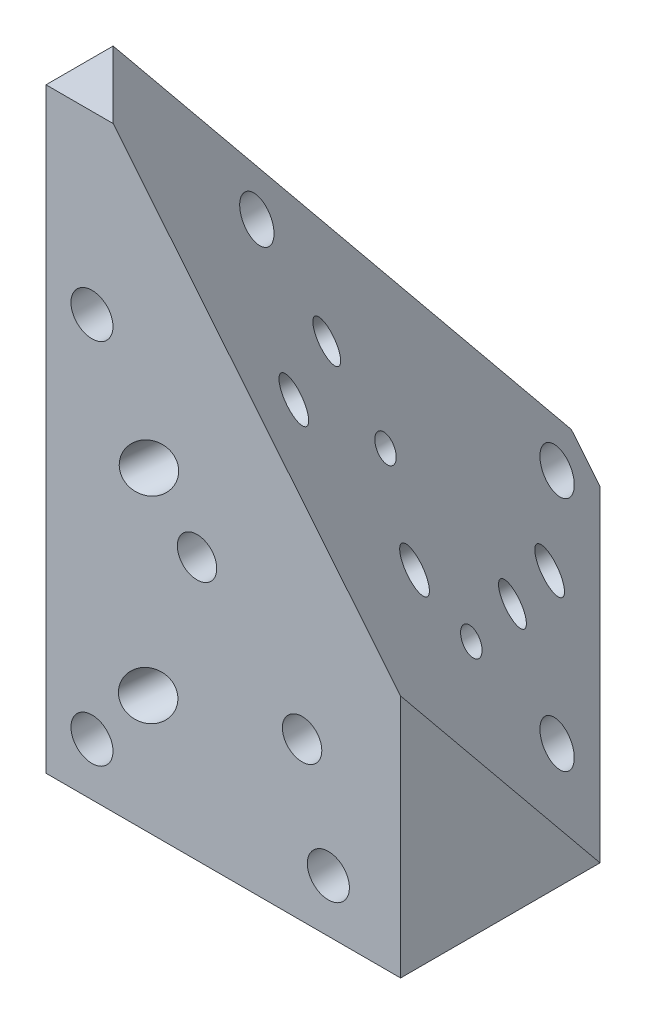
from build123d import *

# Parameters (mm, degrees)
SKETCH1_W                       = 13.5
SKETCH1_H                       = 20
BOSS_EXTRUDE1_DEPTH             = 22.7
SKETCH2_W                       = 50.012416784
SKETCH2_H                       = 57.752903126
CUT_EXTRUDE1_DEPTH              = 22.738253376
M2X0_4_TAPPED_HOLE1_D           = 1.6
M2X0_4_TAPPED_HOLE1_ON_FACE_2_D = 1.6
M2X0_4_TAPPED_HOLE1_ON_FACE_3_D = 1.6
M2X0_4_TAPPED_HOLE3_D           = 1.6
F_1_0MM_DOWEL_HOLE1_D           = 1
F_1_5MM_DOWEL_HOLE1_D           = 1.5
F_1_5MM_DOWEL_HOLE1_DEPTH       = 4.5
F_1_5MM_DOWEL_HOLE1_TIP         = 0.450645464
F_1_0MM_DOWEL_HOLE2_D           = 1
F_1_0MM_DOWEL_HOLE2_ON_FACE_2_D = 1
F_1_5MM_DOWEL_HOLE2_D           = 1.5
F_1_5MM_DOWEL_HOLE2_DEPTH       = 3.5
F_1_5MM_DOWEL_HOLE2_TIP         = 0.450645464


with BuildPart() as part:
    # Sketch1 → Boss-Extrude1 (new body)
    with BuildSketch(Plane(origin=(0, 0, 0), x_dir=(1, 0, 0), z_dir=(0, 1, 0))):
        with Locations((6.75, 10)):
            Rectangle(SKETCH1_W, SKETCH1_H)
    extrude(amount=BOSS_EXTRUDE1_DEPTH)

    # Sketch2 → Cut-Extrude1 (cut, through all)
    with BuildSketch(Plane(origin=(7.909175957, 6.457815127, -7.909175957), x_dir=(0.7905694150420965, -0.3872983346207431, 0.4743416490252531), z_dir=(-0.6123724356957925, -0.5000000000000046, 0.6123724356957929))):
        Rectangle(SKETCH2_W, SKETCH2_H)
    extrude(amount=-CUT_EXTRUDE1_DEPTH, mode=Mode.SUBTRACT)

    # M2x0.4 Tapped Hole1 (through all)
    with Locations(Plane(origin=(6.676828291, 14.276195347, -2.757842905), x_dir=(-0.707106781187, 0, -0.707106781187), z_dir=(0.612372435696, 0.5, -0.612372435696))):
        with Locations((0, 0)):
            Hole(M2X0_4_TAPPED_HOLE1_D / 2)

    # M2x0.4 Tapped Hole1 on face 2 (through all)
    with Locations(Plane(origin=(8.960116926, 8.647059392, -5.07072453), x_dir=(-0.707106781187, 0, -0.707106781187), z_dir=(0.612372326772, 0.500000266808, -0.612372326772))):
        with Locations((0, 0)):
            Hole(M2X0_4_TAPPED_HOLE1_ON_FACE_2_D / 2)

    # M2x0.4 Tapped Hole1 on face 3 (through all)
    with Locations(Plane(origin=(5.257385282, 2.349364905, -13.91550219), x_dir=(-0.707106781187, 0, -0.707106781187), z_dir=(0.612372326772, 0.500000266808, -0.612372326772))):
        with Locations((0, 0)):
            Hole(M2X0_4_TAPPED_HOLE1_ON_FACE_3_D / 2)

    # M2x0.4 Tapped Hole3 (through all)
    with Locations(Plane(origin=(1.75, 16, 0), x_dir=(1, 0, 0), z_dir=(0, 0, 1))):
        with Locations((0, 0), (0, -14), (9, -14)):
            Hole(M2X0_4_TAPPED_HOLE3_D / 2)

    # Ø1.0mm Dowel Hole1 (through all)
    with Locations(Plane(origin=(5.75, 10, 0), x_dir=(1, 0, 0), z_dir=(0, 0, 1))):
        with Locations((0, 0), (4, -4)):
            Hole(F_1_0MM_DOWEL_HOLE1_D / 2)

    # Ø1.5mm Dowel Hole1
    with Locations(Plane(origin=(5.75, 10, 0), x_dir=(1, 0, 0), z_dir=(0, 0, 1))):
        with Locations((0, 0), (4, -4)):
            Hole(F_1_5MM_DOWEL_HOLE1_D / 2, depth=F_1_5MM_DOWEL_HOLE1_DEPTH)
            with Locations((0, 0, -(F_1_5MM_DOWEL_HOLE1_DEPTH + F_1_5MM_DOWEL_HOLE1_TIP / 2))):  # 118° drill point
                Cone(0, F_1_5MM_DOWEL_HOLE1_D / 2, F_1_5MM_DOWEL_HOLE1_TIP, mode=Mode.SUBTRACT)

    # Ø1.0mm Dowel Hole2 (through all)
    with Locations(Plane(origin=(3.84317172, 12.741669751, -6.844434378), x_dir=(-0.707106781187, 0, -0.707106781187), z_dir=(0.612372435696, 0.5, -0.612372435696))):
        with Locations((0, 0)):
            Hole(F_1_0MM_DOWEL_HOLE2_D / 2)

    # Ø1.0mm Dowel Hole2 on face 2 (through all)
    with Locations(Plane(origin=(7.378705626, 4.081415713, -10.379968284), x_dir=(-0.707106781187, 0, -0.707106781187), z_dir=(0.612372326772, 0.500000266808, -0.612372326772))):
        with Locations((0, 0)):
            Hole(F_1_0MM_DOWEL_HOLE2_ON_FACE_2_D / 2)

    # Ø1.5mm Dowel Hole2
    with Locations(Plane(origin=(3.84317172, 12.741669751, -6.844434378), x_dir=(-0.707106781187, 0, -0.707106781187), z_dir=(0.612372435696, 0.5, -0.612372435696))):
        with Locations((0, 0), (0, -10)):
            Hole(F_1_5MM_DOWEL_HOLE2_D / 2, depth=F_1_5MM_DOWEL_HOLE2_DEPTH)
            with Locations((0, 0, -(F_1_5MM_DOWEL_HOLE2_DEPTH + F_1_5MM_DOWEL_HOLE2_TIP / 2))):  # 118° drill point
                Cone(0, F_1_5MM_DOWEL_HOLE2_D / 2, F_1_5MM_DOWEL_HOLE2_TIP, mode=Mode.SUBTRACT)


solid = part.part
